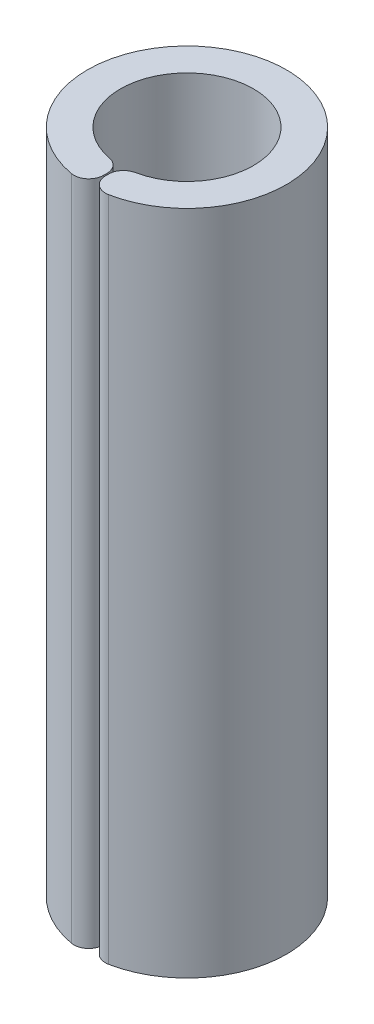
from build123d import *

# Parameters (mm, degrees)
BOSS_EXTRUDE1_DEPTH = 26.8
FILLET1_R           = 0.6


with BuildPart() as part:
    # Sketch1 → Boss-Extrude1 (new body)
    with BuildSketch(Plane(origin=(0, 0, 0), x_dir=(1, 0, 0), z_dir=(0, 1, 0))):
        with BuildLine():
            Line((0.046685187, -2.674592585), (0.069809626, -3.999390781))
            ThreePointArc((0.069809626, -3.999390781), (-0.034906142, 3.999847692), (0, -4))
            Line((0, -4), (0, -2.675))
            ThreePointArc((0, -2.675), (-0.023343482, 2.674898144), (0.046685187, -2.674592585))
        make_face()
    extrude(amount=BOSS_EXTRUDE1_DEPTH)

    # Fillet1
    fillet1_edges = [part.edges().sort_by_distance(p)[0] for p in [
        (0.069809626, 13.4, 3.999390781),
        (0, 13.4, 4),
        (0.046685187, 13.4, 2.674592585),
        (0, 13.4, 2.675),
    ]]
    fillet(fillet1_edges, radius=FILLET1_R)


solid = part.part
